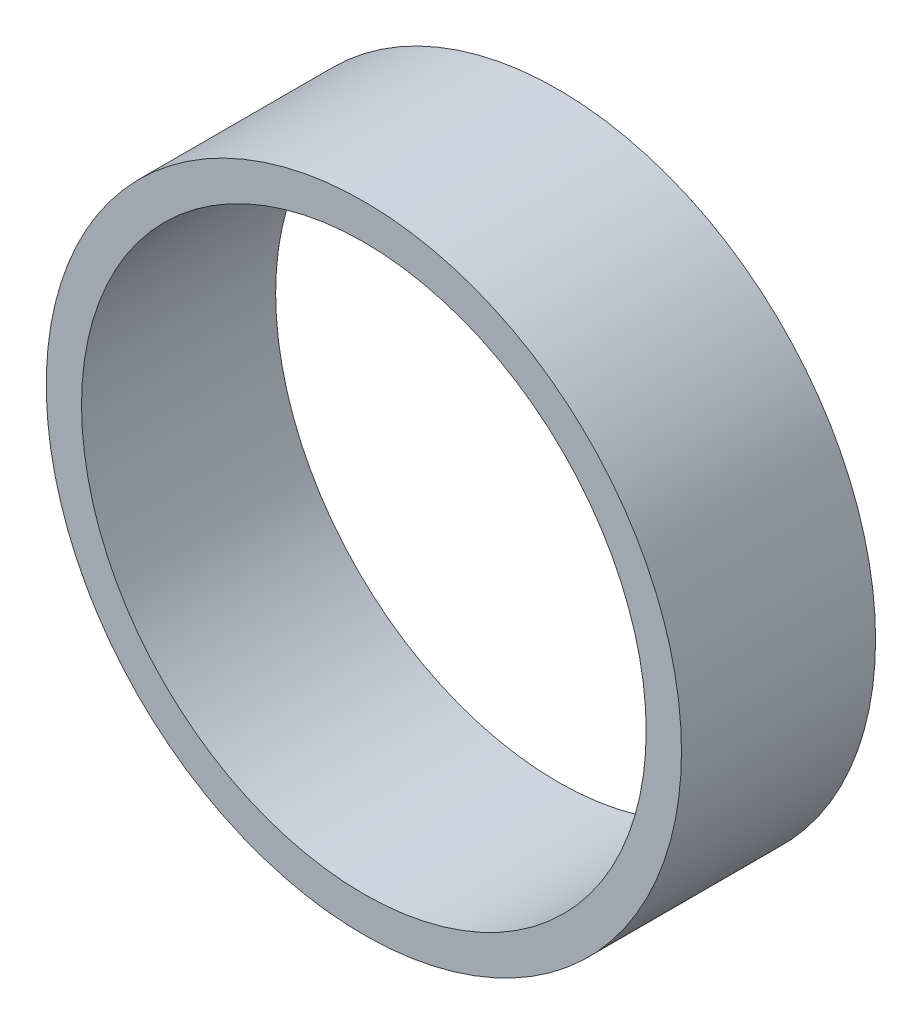
from build123d import *

# Parameters (mm, degrees)
SKETCH_1_R      = 9
SKETCH_1_R_2    = 8
EXTRUDE_1_DEPTH = 5.5


with BuildPart() as part:
    # Эскиз1 → Бобышка-Вытянуть1 (new body)
    with BuildSketch(Plane.XY):
        Circle(SKETCH_1_R)
        Circle(SKETCH_1_R_2, mode=Mode.SUBTRACT)
    extrude(amount=EXTRUDE_1_DEPTH)


solid = part.part
